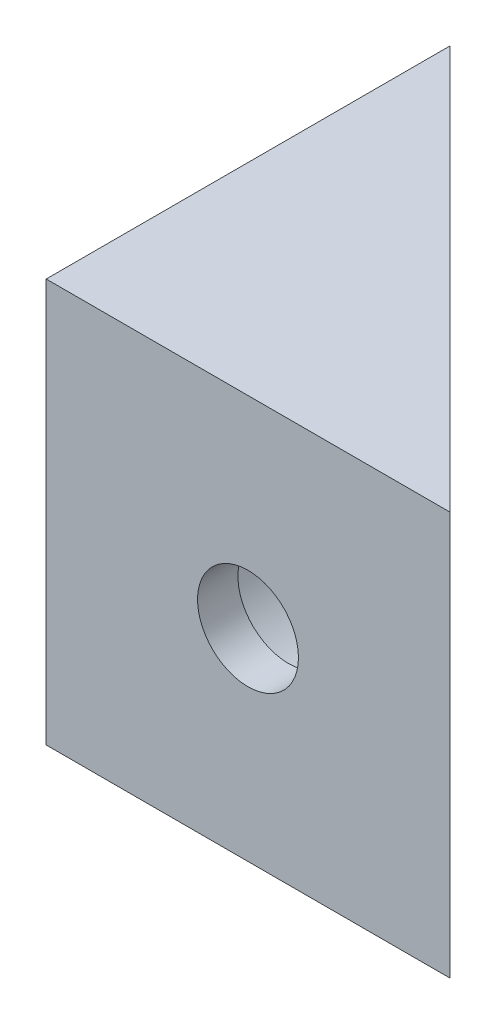
from build123d import *

# Parameters (mm, degrees)
BOSS_EXTRUDE1_DEPTH = 20
SKETCH2_R           = 2.5
CUT_EXTRUDE1_DEPTH  = 35.641016151
SKETCH3_R           = 2.5
CUT_EXTRUDE2_DEPTH  = 35.641016151
CUT_EXTRUDE3_START  = -2
SKETCH4_R           = 5
CUT_EXTRUDE3_DEPTH  = 33.641016151
CUT_EXTRUDE4_START  = -2
SKETCH5_R           = 5
CUT_EXTRUDE4_DEPTH  = 20


with BuildPart() as part:
    # Sketch1 → Boss-Extrude1 (new body)
    with BuildSketch(Plane(origin=(0, 0, 0), x_dir=(1, 0, 0), z_dir=(0, 1, 0))):
        Polygon((0, 0), (0, 20), (20, 0), align=None)
    extrude(amount=BOSS_EXTRUDE1_DEPTH)

    # Sketch2 → Cut-Extrude1 (cut, through all)
    with BuildSketch(Plane.XY):
        with Locations((10, 10)):
            Circle(SKETCH2_R)
    extrude(amount=-CUT_EXTRUDE1_DEPTH, mode=Mode.SUBTRACT)

    # Sketch3 → Cut-Extrude2 (cut, through all)
    with BuildSketch(Plane.ZY):
        with Locations((-10, 10)):
            Circle(SKETCH3_R)
    extrude(amount=-CUT_EXTRUDE2_DEPTH, mode=Mode.SUBTRACT)

    # Sketch4 → Cut-Extrude3 (cut, through all)
    with BuildSketch(Plane.ZY.offset(CUT_EXTRUDE3_START)):
        with Locations((-10, 10)):
            Circle(SKETCH4_R)
    extrude(amount=-CUT_EXTRUDE3_DEPTH, mode=Mode.SUBTRACT)

    # Sketch5 → Cut-Extrude4 (cut)
    with BuildSketch(Plane.XY.offset(CUT_EXTRUDE4_START)):
        with Locations((10, 10)):
            Circle(SKETCH5_R)
    extrude(amount=-CUT_EXTRUDE4_DEPTH, mode=Mode.SUBTRACT)


solid = part.part
